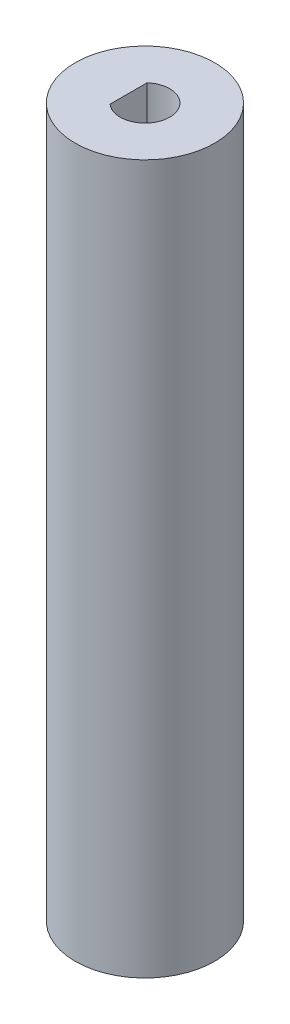
from build123d import *

# Parameters (mm, degrees)
SKETCH1_R           = 5
BOSS_EXTRUDE1_DEPTH = 50.8


with BuildPart() as part:
    # Sketch1 → Boss-Extrude1 (new body)
    with BuildSketch(Plane(origin=(0, 0, 0), x_dir=(1, 0, 0), z_dir=(0, 1, 0))):
        Circle(SKETCH1_R)
        with BuildLine():
            Line((-1.176, 1.328194263), (-1.176, -1.328194263))
            ThreePointArc((-1.176, -1.328194263), (1.774, 0), (-1.176, 1.328194263))
        make_face(mode=Mode.SUBTRACT)
    extrude(amount=BOSS_EXTRUDE1_DEPTH)


solid = part.part
